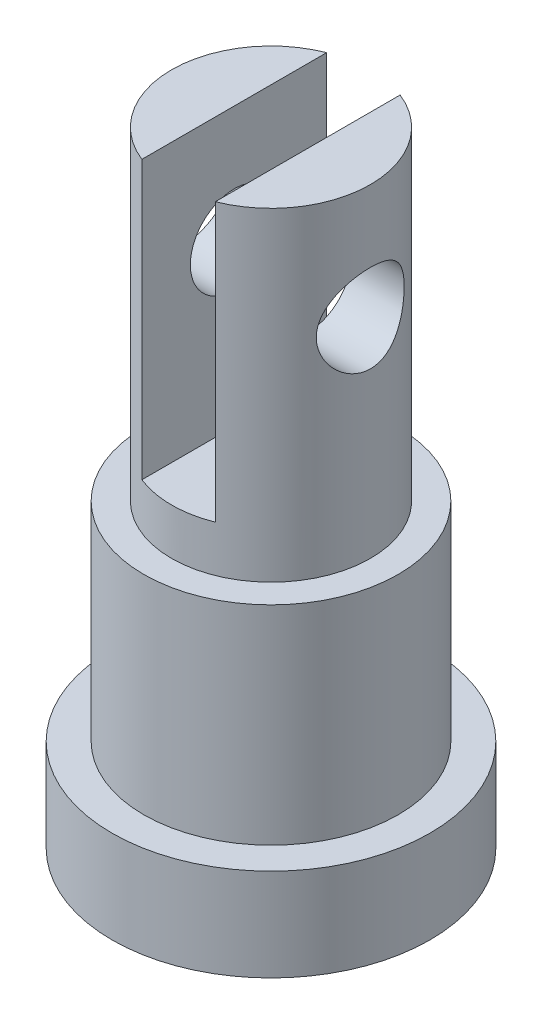
from build123d import *

# Parameters (mm, degrees)
SKETCH1_R               = 6.875
BOSS_EXTRUDE1_DEPTH     = 4
SKETCH2_R               = 5.5
BOSS_EXTRUDE2_DEPTH     = 9
SKETCH3_R               = 4.3
BOSS_EXTRUDE3_DEPTH     = 14
SKETCH4_W               = 3.175
SKETCH4_H               = 8.6
CUT_EXTRUDE1_DEPTH      = 12
CUT_EXTRUDE2_DEPTH      = 30.118371027
CUT_EXTRUDE2_DEPTH_BACK = 30.118371027
SKETCH5_R               = 1.9


with BuildPart() as part:
    # Sketch1 → Boss-Extrude1 (new body)
    with BuildSketch(Plane(origin=(0, 0, 0), x_dir=(1, 0, 0), z_dir=(0, 1, 0))):
        Circle(SKETCH1_R)
    extrude(amount=BOSS_EXTRUDE1_DEPTH)

    # Sketch2 → Boss-Extrude2 (add)
    with BuildSketch(Plane(origin=(0, 4, 0), x_dir=(1, 0, 0), z_dir=(0, 1, 0))):
        Circle(SKETCH2_R)
    extrude(amount=BOSS_EXTRUDE2_DEPTH)

    # Sketch3 → Boss-Extrude3 (add)
    with BuildSketch(Plane(origin=(0, 13, 0), x_dir=(1, 0, 0), z_dir=(0, 1, 0))):
        Circle(SKETCH3_R)
    extrude(amount=BOSS_EXTRUDE3_DEPTH)

    # Sketch4 → Cut-Extrude1 (cut)
    with BuildSketch(Plane(origin=(0, 27, 0), x_dir=(1, 0, 0), z_dir=(0, 1, 0))):
        Rectangle(SKETCH4_W, SKETCH4_H)
    extrude(amount=-CUT_EXTRUDE1_DEPTH, mode=Mode.SUBTRACT)

    # Sketch5 → Cut-Extrude2 (cut, two sides: drawn at the far end of the back side and taken through both)
    with BuildSketch(Plane.ZY.offset(-1.5875).offset(-CUT_EXTRUDE2_DEPTH_BACK)):
        with Locations((0, 22)):
            Circle(SKETCH5_R)
    extrude(amount=CUT_EXTRUDE2_DEPTH + CUT_EXTRUDE2_DEPTH_BACK, mode=Mode.SUBTRACT)


solid = part.part
